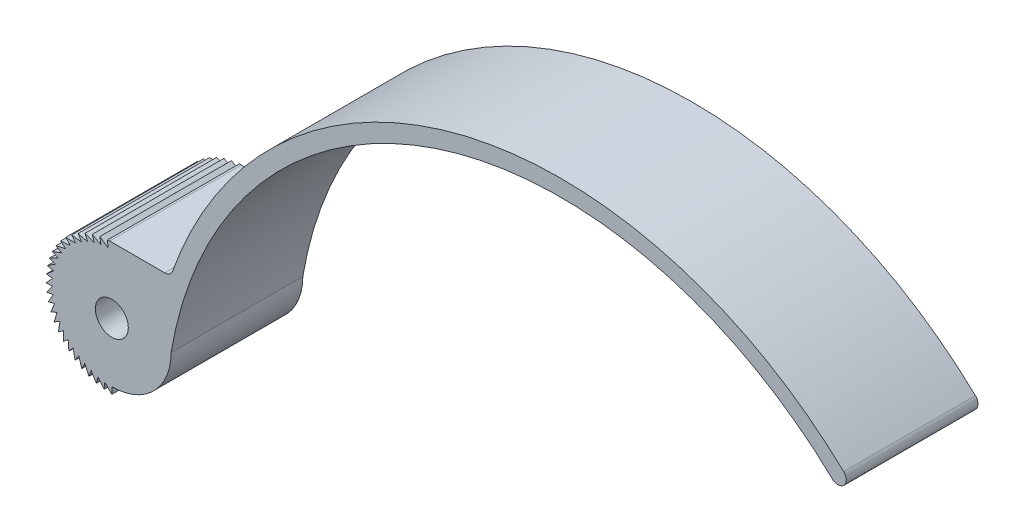
from build123d import *

# Parameters (mm, degrees)
SKETCH1_R           = 3.175
BOSS_EXTRUDE1_DEPTH = 25.4
FILLET1_R           = 1.5875
CUT_EXTRUDE4_START  = -25.4
CUT_EXTRUDE4_DEPTH  = 25.4


# Read off the part's stored shape, not the designer's step: Cut-Extrude4
with BuildPart() as part:
    # Sketch1 → Boss-Extrude1 (new body)
    with BuildSketch(Plane.XY):
        with BuildLine():
            ThreePointArc((11.43, 0), (63.136132054, 59.809068479), (140.062658489, 41.561923634))
            Line((140.062658489, 41.561923634), (142.291760374, 43.822837119))
            ThreePointArc((142.291760374, 43.822837119), (68.204193197, 64.522407945), (11.360686049, 12.693308612))
            Line((11.360686049, 12.693308612), (-0.412209266, 12.693308612))
            ThreePointArc((-0.412209266, 12.693308612), (-12.698327043, -0.206131786), (0, -12.7))
            Line((0, -12.7), (0, -11.43))
            ThreePointArc((0, -11.43), (8.082230509, -8.082230509), (11.43, 0))
        make_face()
        Circle(SKETCH1_R, mode=Mode.SUBTRACT)
    extrude(amount=BOSS_EXTRUDE1_DEPTH)

    # Fillet1
    fillet1_edges = [part.edges().sort_by_distance(p)[0] for p in [
        (11.360686049, 12.693308612, 12.7),
        (142.291760374, 43.822837119, 12.7),
        (140.062658489, 41.561923634, 12.7),
    ]]
    fillet(fillet1_edges, radius=FILLET1_R - 0.0001)  # a hair under: the kernel refuses the full size

    # Cut-Extrude4 outline → Cut-Extrude4 (cut)
    with BuildSketch(Plane.XY.offset(25.4).offset(CUT_EXTRUDE4_START)):
        with BuildLine():
            Line((0, -12.7), (-1.350005, -11.349995))
            Line((-1.350005, -11.349995), (-1.499925014, -12.610428411))
            Line((-1.499925014, -12.610428411), (-1.499328355, -12.611186086))
            ThreePointArc((-1.499328355, -12.611186086), (-0.750978267, -12.677777078), (0, -12.7))
        make_face()
        with BuildLine():
            Line((-1.500005556, -12.611105556), (-1.499925014, -12.610428411))
            Line((-1.499925014, -12.610428411), (-2.680514457, -11.111243956))
            Line((-2.680514457, -11.111243956), (-2.978189476, -12.345163717))
            Line((-2.978189476, -12.345163717), (-2.977686438, -12.345986533))
            ThreePointArc((-2.977686438, -12.345986533), (-2.242766912, -12.500399857), (-1.500005556, -12.611105556))
        make_face()
        with BuildLine():
            Line((-2.978349396, -12.345826618), (-2.978189476, -12.345163717))
            Line((-2.978189476, -12.345163717), (-3.97353305, -10.717086129))
            Line((-3.97353305, -10.717086129), (-4.41479966, -11.907234092))
            Line((-4.41479966, -11.907234092), (-4.41439728, -11.908110541))
            ThreePointArc((-4.41439728, -11.908110541), (-3.702846837, -12.14820667), (-2.978349396, -12.345826618))
        make_face()
        with BuildLine():
            Line((-4.415036722, -11.907873477), (-4.41479966, -11.907234092))
            Line((-4.41479966, -11.907234092), (-5.210976049, -10.173034386))
            Line((-5.210976049, -10.173034386), (-5.789662499, -11.302764613))
            Line((-5.789662499, -11.302764613), (-5.789366404, -11.303682437))
            ThreePointArc((-5.789366404, -11.303682437), (-5.111137104, -11.626103281), (-4.415036722, -11.907873477))
        make_face()
        with BuildLine():
            Line((-5.789973388, -11.30337154), (-5.789662499, -11.302764613))
            Line((-5.789662499, -11.302764613), (-6.375536027, -9.486698075))
            Line((-6.375536027, -9.486698075), (-7.083548553, -10.540209659))
            Line((-7.083548553, -10.540209659), (-7.083362884, -10.541156021))
            ThreePointArc((-7.083362884, -10.541156021), (-6.447940742, -10.941392059), (-5.789973388, -11.30337154))
        make_face()
        with BuildLine():
            Line((-7.083928919, -10.540775639), (-7.083548553, -10.540209659))
            Line((-7.083548553, -10.540209659), (-7.450924933, -8.6676766))
            Line((-7.450924933, -8.6676766), (-8.278360957, -9.630234661))
            Line((-8.278360957, -9.630234661), (-8.278288311, -9.631196324))
            ThreePointArc((-8.278288311, -9.631196324), (-7.694560624, -10.103649678), (-7.083928919, -10.540775639))
        make_face()
        with BuildLine():
            Line((-8.278805481, -9.630751778), (-8.278360957, -9.630234661))
            Line((-8.278360957, -9.630234661), (-8.4221019, -7.727425158))
            Line((-8.4221019, -7.727425158), (-9.357388535, -8.585566933))
            Line((-9.357388535, -8.585566933), (-9.357429929, -8.586530447))
            ThreePointArc((-9.357429929, -8.586530447), (-8.83356097, -9.124593174), (-8.278805481, -9.630751778))
        make_face()
        with BuildLine():
            Line((-9.357891, -8.586027954), (-9.357388535, -8.585566933))
            Line((-9.357388535, -8.585566933), (-9.275483618, -6.679094524))
            Line((-9.275483618, -6.679094524), (-10.30553953, -7.420817661))
            Line((-10.30553953, -7.420817661), (-10.305694385, -7.42176955))
            ThreePointArc((-10.305694385, -7.42176955), (-9.849011217, -8.017916066), (-9.357891, -8.586027954))
        make_face()
        with BuildLine():
            Line((-10.306092909, -7.421216137), (-10.30553953, -7.420817661))
            Line((-10.30553953, -7.420817661), (-9.99913431, -5.537347113))
            Line((-9.99913431, -5.537347113), (-11.109552682, -6.152277543))
            Line((-11.109552682, -6.152277543), (-11.109818831, -6.153204494))
            ThreePointArc((-11.109818831, -6.153204494), (-10.726708829, -6.79909683), (-10.306092909, -7.421216137))
        make_face()
        with BuildLine():
            Line((-11.110149234, -6.152607903), (-11.109552682, -6.152277543))
            Line((-11.109552682, -6.152277543), (-10.582932678, -4.318151911))
            Line((-10.582932678, -4.318151911), (-11.758182706, -4.797688945))
            Line((-11.758182706, -4.797688945), (-11.758556427, -4.798577993))
            ThreePointArc((-11.758556427, -4.798577993), (-11.454377936, -5.485182413), (-11.110149234, -6.152607903))
        make_face()
        with BuildLine():
            Line((-11.758814087, -4.797946568), (-11.758182706, -4.797688945))
            Line((-11.758182706, -4.797688945), (-11.01871346, -3.038561122))
            Line((-11.01871346, -3.038561122), (-12.242357575, -3.375997743))
            Line((-12.242357575, -3.375997743), (-12.242833641, -3.376836453))
            ThreePointArc((-12.242833641, -3.376836453), (-12.021841037, -4.094549803), (-11.758814087, -4.797946568))
        make_face()
        with BuildLine():
            Line((-12.243014955, -3.376179025), (-12.242357575, -3.375997743))
            Line((-12.242357575, -3.375997743), (-11.300381631, -1.716471671))
            Line((-11.300381631, -1.716471671), (-12.555305405, -1.907088341))
            Line((-12.555305405, -1.907088341), (-12.555877158, -1.907864982))
            ThreePointArc((-12.555877158, -1.907864982), (-12.421161341, -2.646649005), (-12.243014955, -3.376179025))
        make_face()
        with BuildLine():
            Line((-12.55597959, -1.907190746), (-12.555305405, -1.907088341))
            Line((-12.555305405, -1.907088341), (-11.423997656, -0.370374887))
            Line((-11.423997656, -0.370374887), (-12.692649169, -0.411505555))
            Line((-12.692649169, -0.411505555), (-12.693308612, -0.412209266))
            ThreePointArc((-12.693308612, -0.412209266), (-12.646753777, -1.161731001), (-12.55597959, -1.907190746))
        make_face()
        with BuildLine():
            Line((-12.693330729, -0.411527652), (-12.692649169, -0.411505555))
            Line((-12.692649169, -0.411505555), (-11.387832587, 0.980902125))
            Line((-11.387832587, 0.980902125), (-12.652467917, 1.089832729))
            Line((-12.652467917, 1.089832729), (-12.653205826, 1.089211792))
            ThreePointArc((-12.653205826, 1.089211792), (-12.695463109, 0.339435488), (-12.693330729, -0.411527652))
        make_face()
        with BuildLine():
            Line((-12.653147319, 1.08989125), (-12.652467917, 1.089832729))
            Line((-12.652467917, 1.089832729), (-11.192392243, 2.318459805))
            Line((-11.192392243, 2.318459805), (-12.43532364, 2.57592813))
            Line((-12.43532364, 2.57592813), (-12.436129695, 2.575398651))
            ThreePointArc((-12.436129695, 2.575398651), (-12.566608068, 1.835854481), (-12.653147319, 1.08989125))
        make_face()
        with BuildLine():
            Line((-12.435991382, 2.57606645), (-12.43532364, 2.57592813))
            Line((-12.43532364, 2.57592813), (-10.840410142, 3.623590479))
            Line((-10.840410142, 3.623590479), (-12.044253415, 4.025995459))
            Line((-12.044253415, 4.025995459), (-12.045116342, 4.025564843))
            ThreePointArc((-12.045116342, 4.025564843), (-12.261990876, 3.306596401), (-12.435991382, 2.57606645))
        make_face()
        with BuildLine():
            Line((-12.044900158, 4.026211643), (-12.044253415, 4.025995459))
            Line((-12.044253415, 4.025995459), (-10.336809259, 4.87804001))
            Line((-10.336809259, 4.87804001), (-11.484726924, 5.41975343))
            Line((-11.484726924, 5.41975343), (-11.485634654, 5.419427701))
            ThreePointArc((-11.485634654, 5.419427701), (-11.785872046, 4.731090797), (-12.044900158, 4.026211643))
        make_face()
        with BuildLine():
            Line((-11.485343621, 5.420044456), (-11.484726924, 5.41975343))
            Line((-11.484726924, 5.41975343), (-9.688633181, 6.064263112))
            Line((-9.688633181, 6.064263112), (-10.764569952, 6.737708328))
            Line((-10.764569952, 6.737708328), (-10.765509788, 6.737492041))
            ThreePointArc((-10.765509788, 6.737492041), (-11.144910785, 6.089414061), (-11.485343621, 5.420044456))
        make_face()
        with BuildLine():
            Line((-10.765147979, 6.738070124), (-10.764569952, 6.737708328))
            Line((-10.764569952, 6.737708328), (-8.904947585, 7.165668741))
            Line((-8.904947585, 7.165668741), (-9.893854933, 7.961426651))
            Line((-9.893854933, 7.961426651), (-9.894813732, 7.961322831))
            ThreePointArc((-9.894813732, 7.961322831), (-10.348071862, 7.36256808), (-10.765147979, 6.738070124))
        make_face()
        with BuildLine():
            Line((-9.894386205, 7.961854157), (-9.893854933, 7.961426651))
            Line((-9.893854933, 7.961426651), (-7.996713445, 8.166852152))
            Line((-7.996713445, 8.166852152), (-8.884769963, 9.073803031))
            Line((-8.884769963, 9.073803031), (-8.885724425, 9.073803031))
            ThreePointArc((-8.885724425, 9.073803031), (-9.40650022, 8.532745959), (-9.894386205, 7.961854157))
        make_face()
        with BuildLine():
            Line((-8.885237161, 9.074280169), (-8.884769963, 9.073803031))
            Line((-8.884769963, 9.073803031), (-6.976633727, 9.053810349))
            Line((-6.976633727, 9.053810349), (-7.751399024, 10.059249124))
            Line((-7.751399024, 10.059249124), (-7.752355437, 10.059373001))
            ThreePointArc((-7.752355437, 10.059373001), (-8.333365097, 9.583581072), (-8.885237161, 9.074280169))
        make_face()
        with BuildLine():
            Line((-7.751815252, 10.059789277), (-7.751399024, 10.059249124))
            Line((-7.751399024, 10.059249124), (-5.858975717, 9.814137942))
            Line((-5.858975717, 9.814137942), (-6.50962347, 10.904012199))
            Line((-6.50962347, 10.904012199), (-6.510558571, 10.904248121))
            ThreePointArc((-6.510558571, 10.904248121), (-7.143675836, 10.500375972), (-7.751815252, 10.059789277))
        make_face()
        with BuildLine():
            Line((-6.509973019, 10.904597714), (-6.50962347, 10.904012199))
            Line((-6.50962347, 10.904012199), (-4.659371476, 10.437200652))
            Line((-4.659371476, 10.437200652), (-5.176801438, 11.596266927))
            Line((-5.176801438, 11.596266927), (-5.177702147, 11.596611595))
            ThreePointArc((-5.177702147, 11.596611595), (-5.854071959, 11.27030796), (-6.509973019, 10.904597714))
        make_face()
        with BuildLine():
            Line((-5.177079418, 11.596889613), (-5.176801438, 11.596266927))
            Line((-5.176801438, 11.596266927), (-3.3945992, 10.914284047))
            Line((-3.3945992, 10.914284047), (-3.771574366, 12.126331125))
            Line((-3.771574366, 12.126331125), (-3.772428086, 12.126779718))
            ThreePointArc((-3.772428086, 12.126779718), (-4.482590437, 11.882608425), (-5.177079418, 11.596889613))
        make_face()
        with BuildLine():
            Line((-3.771776889, 12.126982275), (-3.771574366, 12.126331125))
            Line((-3.771574366, 12.126331125), (-2.082348556, 11.238715429))
            Line((-2.082348556, 11.238715429), (-2.313596384, 12.486791082))
            Line((-2.313596384, 12.486791082), (-2.314391174, 12.487337326))
            ThreePointArc((-2.314391174, 12.487337326), (-3.048413417, 12.328713462), (-3.771776889, 12.126982275))
        make_face()
        with BuildLine():
            Line((-2.313720618, 12.487461588), (-2.313596384, 12.486791082))
            Line((-2.313596384, 12.486791082), (-0.740973262, 11.405957155))
            Line((-0.740973262, 11.405957155), (-0.823303624, 12.673285728))
            ThreePointArc((-0.823303624, 12.673285728), (-1.571261572, 12.602425841), (-2.313720618, 12.487461588))
        make_face()
    extrude(amount=CUT_EXTRUDE4_DEPTH, mode=Mode.SUBTRACT)


solid = part.part
